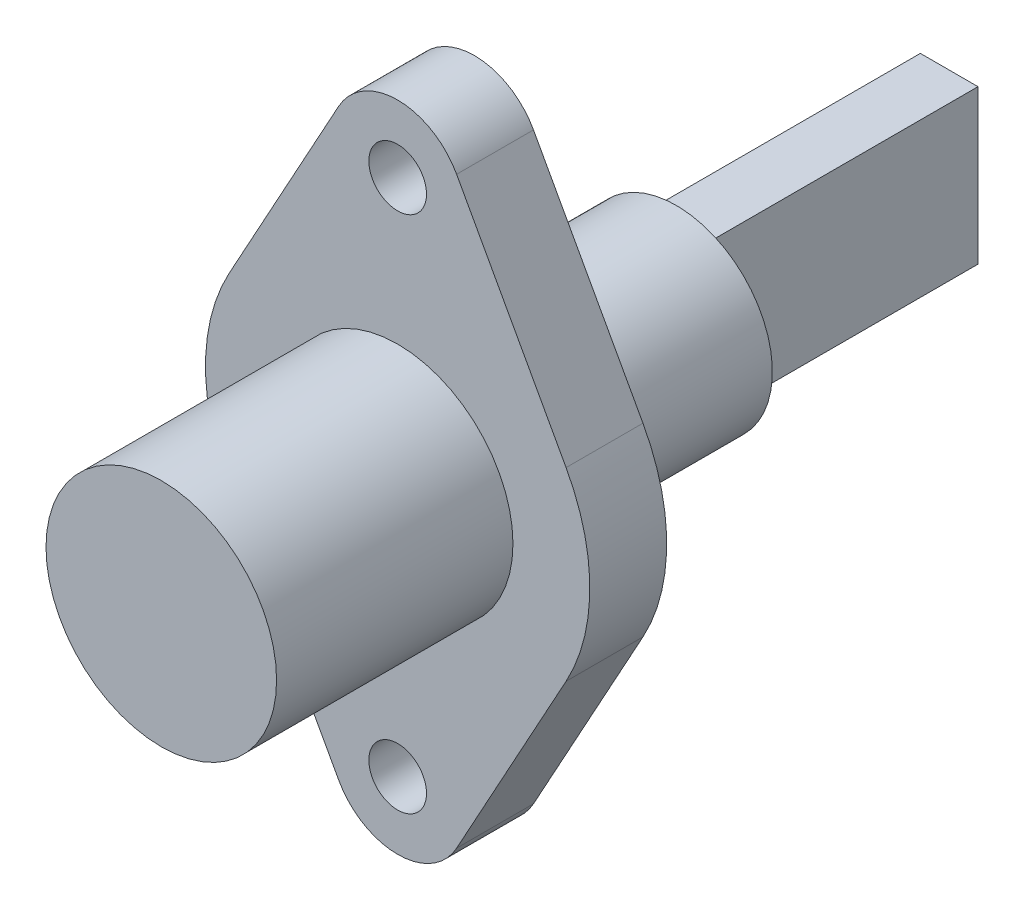
from build123d import *

# Parameters (mm, degrees)
SKETCH1_R           = 1.5
BOSS_EXTRUDE1_DEPTH = 4
SKETCH2_R           = 6
BOSS_EXTRUDE2_DEPTH = 12.3
SKETCH3_R           = 7.5
BOSS_EXTRUDE3_DEPTH = 0.5
SKETCH4_W           = 3
SKETCH4_H           = 8
BOSS_EXTRUDE4_DEPTH = 24.2
SKETCH5_R           = 5
BOSS_EXTRUDE5_DEPTH = 10


with BuildPart() as part:
    # Sketch1 → Boss-Extrude1 (new body)
    with BuildSketch(Plane.XY):
        with BuildLine():
            Line((-3.067596925, 15.185185185), (-8.764562642, 4.814814815))
            ThreePointArc((-8.764562642, 4.814814815), (-10, 0), (-8.764562642, -4.814814815))
            Line((-8.764562642, -4.814814815), (-3.067596925, -15.185185185))
            ThreePointArc((-3.067596925, -15.185185185), (0, -17), (3.067596925, -15.185185185))
            Line((3.067596925, -15.185185185), (8.764562642, -4.814814815))
            ThreePointArc((8.764562642, -4.814814815), (10, 0), (8.764562642, 4.814814815))
            Line((8.764562642, 4.814814815), (3.067596925, 15.185185185))
            ThreePointArc((3.067596925, 15.185185185), (0, 17), (-3.067596925, 15.185185185))
        make_face()
        with Locations((0, 13.5)):
            Circle(SKETCH1_R, mode=Mode.SUBTRACT)
        with Locations((0, -13.5)):
            Circle(SKETCH1_R, mode=Mode.SUBTRACT)
    extrude(amount=BOSS_EXTRUDE1_DEPTH)

    # Sketch2 → Boss-Extrude2 (add)
    with BuildSketch(Plane.XY.offset(4)):
        Circle(SKETCH2_R)
    extrude(amount=BOSS_EXTRUDE2_DEPTH)

    # Sketch3 → Boss-Extrude3 (add)
    with BuildSketch(Plane(origin=(0, 0, 0), x_dir=(-1, 0, 0), z_dir=(0, 0, -1))):
        Circle(SKETCH3_R)
    extrude(amount=BOSS_EXTRUDE3_DEPTH)

    # Sketch4 → Boss-Extrude4 (add)
    with BuildSketch(Plane(origin=(0, 0, -0.5), x_dir=(-1, 0, 0), z_dir=(0, 0, -1))):
        Rectangle(SKETCH4_W, SKETCH4_H)
    extrude(amount=BOSS_EXTRUDE4_DEPTH)

    # Sketch5 → Boss-Extrude5 (add)
    with BuildSketch(Plane(origin=(0, 0, -0.5), x_dir=(-1, 0, 0), z_dir=(0, 0, -1))):
        Circle(SKETCH5_R)
    extrude(amount=BOSS_EXTRUDE5_DEPTH)


solid = part.part
